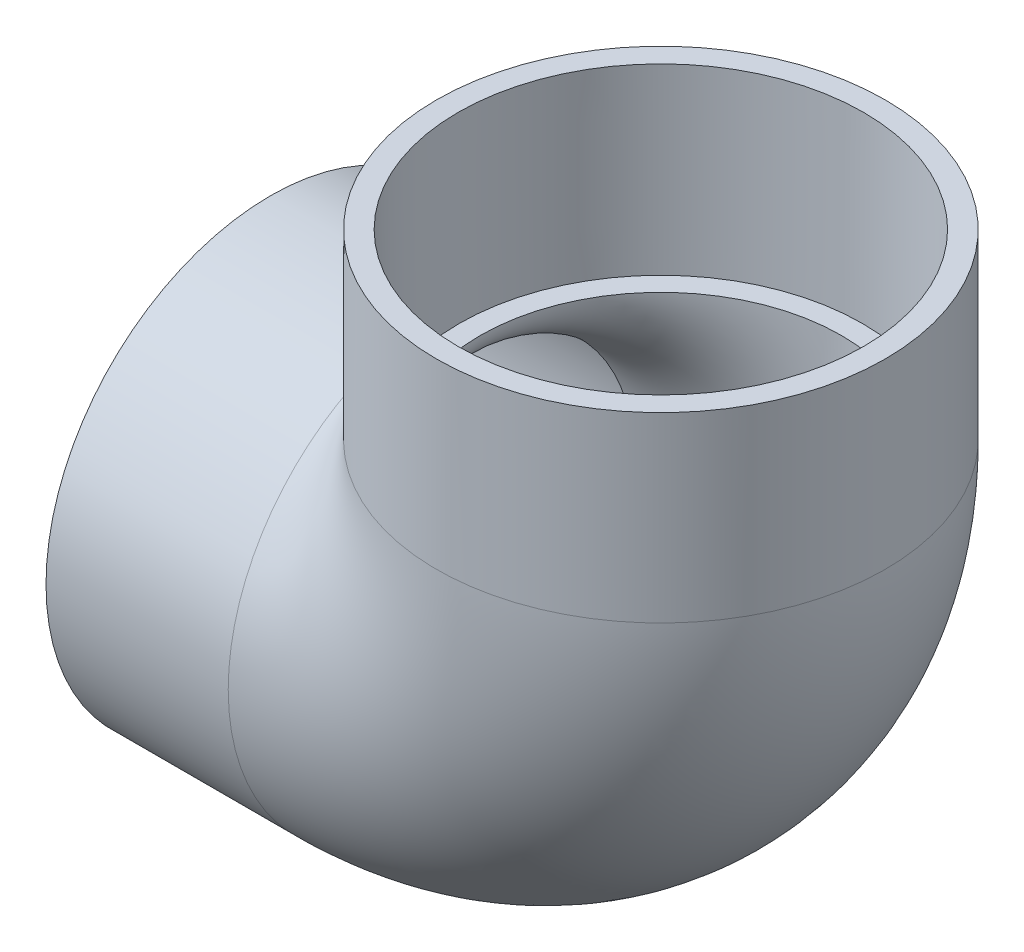
from build123d import *

# Parameters (mm, degrees)
SKETCH3_R   = 63.5
SKETCH3_R_2 = 51.1302


with BuildPart() as part:
    # Sketch1 → Revolve1 (revolve)
    with BuildSketch(Plane.XY):
        Polygon((-110.49, -63.5), (-58.928, -63.5), (-58.928, -57.0357), (-110.49, -57.3786), align=None)
    revolve(axis=Axis((-110.49, 0, 0), (1, 0, 0)))


with BuildPart() as body_2:
    # Sketch2 → Revolve2 (revolve)
    with BuildSketch(Plane.XY):
        Polygon((57.3786, 110.49), (57.0357, 58.928), (63.5, 58.928), (63.5, 110.49), align=None)
    revolve(axis=Axis((0, 0, 0), (0, 1, 0)))


with BuildPart() as sweep1_tool:
    # Sweep1: sweep along a path in Sketch4
    with BuildLine(Plane.XY) as sweep1_path:
        ThreePointArc((-58.928, 0), (-17.259612, 17.259612), (0, 58.928))
    # Sketch3 → Sweep1 (sweep)
    with BuildSketch(Plane(origin=(-58.928, 0, 0), x_dir=(0, 0, -1), z_dir=(1, 0, 0))):
        Circle(SKETCH3_R)
        Circle(SKETCH3_R_2, mode=Mode.SUBTRACT)
    sweep(path=sweep1_path.line)


with BuildPart() as part_1:
    add(part.part)


with BuildPart() as part_2:
    # Sweep1: joined with sweep1_tool
    add(part_1.part.fuse(sweep1_tool.part, body_2.part, tol=0.00001))


solid = part_2.part
